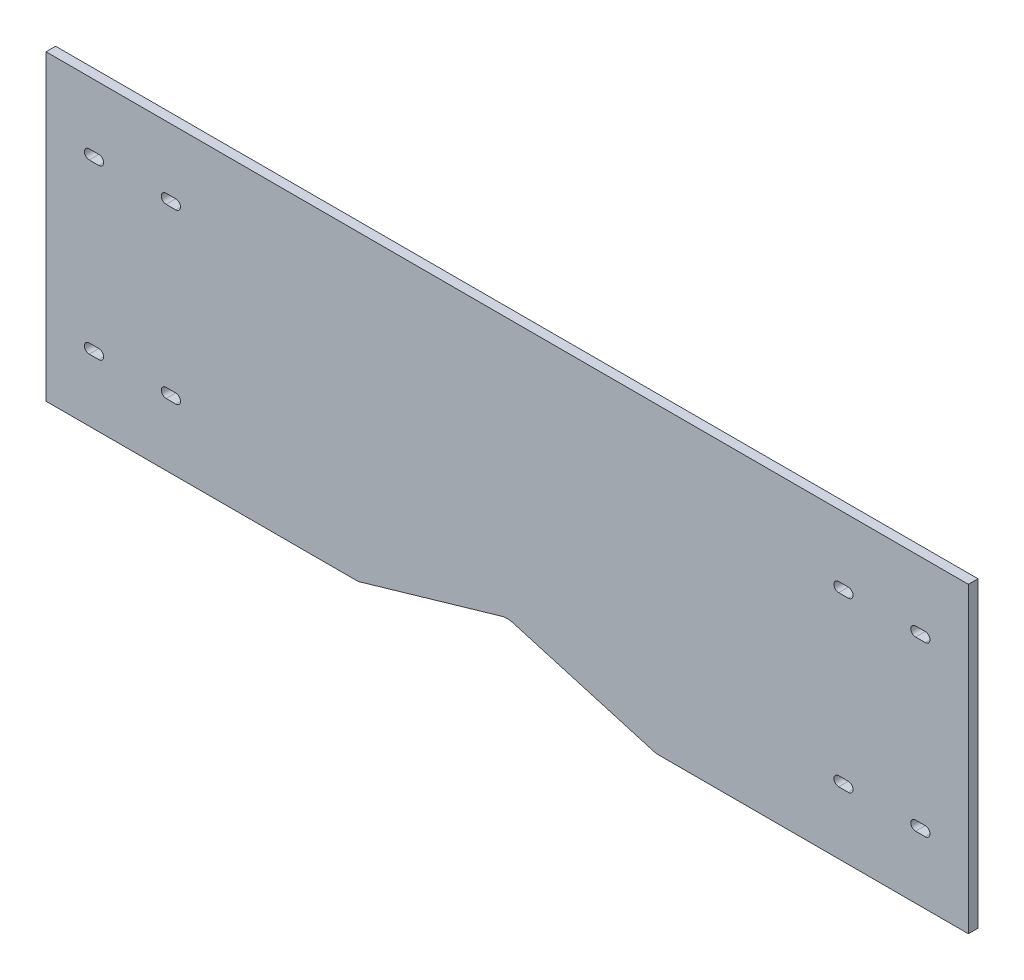
from build123d import *

# Parameters (mm, degrees)
SKETCH1_W                       = 609.6
SKETCH1_H                       = 200.025
BOSS_EXTRUDE1_DEPTH             = 6.35
F_1_4_0_25_DIAMETER_SLOT1_DEPTH = 6.35
CUT_EXTRUDE1_DEPTH              = 321.85177677


# Read off the part's stored shape, not the designer's step: 1/4 (0.25) Diameter Slot1
with BuildPart() as part:
    # Sketch1 → Boss-Extrude1 (new body)
    with BuildSketch(Plane.XY):
        Rectangle(SKETCH1_W, SKETCH1_H)
    extrude(amount=BOSS_EXTRUDE1_DEPTH)

    # 1/4 (0.25) Diameter Slot1 outline → 1/4 (0.25) Diameter Slot1 (cut)
    with BuildSketch(Plane.XY):
        with BuildLine():
            Line((219.075, -58.7375), (225.425, -58.7375))
            ThreePointArc((225.425, -58.7375), (228.6, -55.5625), (225.425, -52.3875))
            Line((225.425, -52.3875), (219.075, -52.3875))
            ThreePointArc((219.075, -52.3875), (215.9, -55.5625), (219.075, -58.7375))
        make_face()
        with BuildLine():
            ThreePointArc((-219.075, -58.7375), (-215.9, -55.5625), (-219.075, -52.3875))
            Line((-219.075, -52.3875), (-225.425, -52.3875))
            ThreePointArc((-225.425, -52.3875), (-228.6, -55.5625), (-225.425, -58.7375))
            Line((-225.425, -58.7375), (-219.075, -58.7375))
        make_face()
        with BuildLine():
            ThreePointArc((276.225, -58.7375), (279.4, -55.5625), (276.225, -52.3875))
            Line((276.225, -52.3875), (269.875, -52.3875))
            ThreePointArc((269.875, -52.3875), (266.7, -55.5625), (269.875, -58.7375))
            Line((269.875, -58.7375), (276.225, -58.7375))
        make_face()
        with BuildLine():
            ThreePointArc((-269.875, -58.7375), (-266.7, -55.5625), (-269.875, -52.3875))
            Line((-269.875, -52.3875), (-276.225, -52.3875))
            ThreePointArc((-276.225, -52.3875), (-279.4, -55.5625), (-276.225, -58.7375))
            Line((-276.225, -58.7375), (-269.875, -58.7375))
        make_face()
        with BuildLine():
            Line((219.075, 52.3875), (225.425, 52.3875))
            ThreePointArc((225.425, 52.3875), (228.6, 55.5625), (225.425, 58.7375))
            Line((225.425, 58.7375), (219.075, 58.7375))
            ThreePointArc((219.075, 58.7375), (215.9, 55.5625), (219.075, 52.3875))
        make_face()
        with BuildLine():
            ThreePointArc((-219.075, 52.3875), (-215.9, 55.5625), (-219.075, 58.7375))
            Line((-219.075, 58.7375), (-225.425, 58.7375))
            ThreePointArc((-225.425, 58.7375), (-228.6, 55.5625), (-225.425, 52.3875))
            Line((-225.425, 52.3875), (-219.075, 52.3875))
        make_face()
        with BuildLine():
            ThreePointArc((276.225, 52.3875), (279.4, 55.5625), (276.225, 58.7375))
            Line((276.225, 58.7375), (269.875, 58.7375))
            ThreePointArc((269.875, 58.7375), (266.7, 55.5625), (269.875, 52.3875))
            Line((269.875, 52.3875), (276.225, 52.3875))
        make_face()
        with BuildLine():
            ThreePointArc((-269.875, 52.3875), (-266.7, 55.5625), (-269.875, 58.7375))
            Line((-269.875, 58.7375), (-276.225, 58.7375))
            ThreePointArc((-276.225, 58.7375), (-279.4, 55.5625), (-276.225, 52.3875))
            Line((-276.225, 52.3875), (-269.875, 52.3875))
        make_face()
    extrude(amount=F_1_4_0_25_DIAMETER_SLOT1_DEPTH, mode=Mode.SUBTRACT)

    # Sketch4 → Cut-Extrude1 (cut, through all)
    with BuildSketch(Plane.XY.offset(6.35)):
        with BuildLine():
            Line((-98.425, -100.0125), (-3.540889475, -72.46550017))
            ThreePointArc((-3.540889475, -72.46550017), (0, -71.96189725), (3.540889475, -72.46550017))
            Line((3.540889475, -72.46550017), (98.425, -100.0125))
            Line((98.425, -100.0125), (-98.425, -100.0125))
        make_face()
    extrude(amount=-CUT_EXTRUDE1_DEPTH, mode=Mode.SUBTRACT)


solid = part.part
